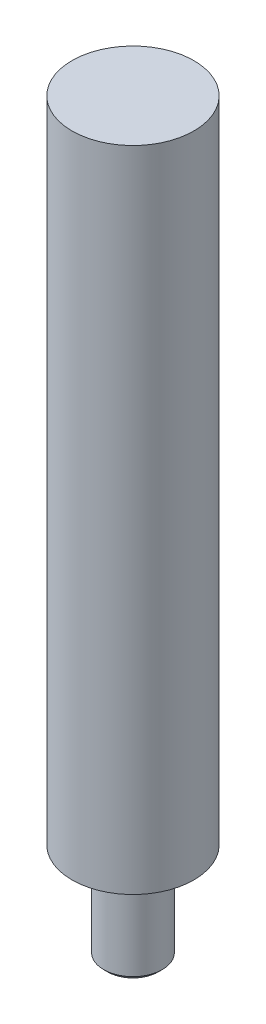
from build123d import *

# Parameters (mm, degrees)
SKETCH1_R           = 12.5
BOSS_EXTRUDE1_DEPTH = 133
SKETCH2_R           = 10
BOSS_EXTRUDE2_DEPTH = 20


# Read off the part's stored shape, not the designer's step: M12x1.5 Machine Threads Stud1
with BuildPart() as part:
    # Sketch1 → Boss-Extrude1 (new body)
    with BuildSketch(Plane(origin=(0, 0, 0), x_dir=(1, 0, 0), z_dir=(0, 1, 0))):
        with Locations(Location((0, 0, 0), (0, 0, 270))):
            Circle(SKETCH1_R)
    extrude(amount=BOSS_EXTRUDE1_DEPTH)

    # Sketch2 → Boss-Extrude2 (add)
    with BuildSketch(Plane.XZ):
        with Locations(Location((0, 0, 0), (0, 0, 270))):
            Circle(SKETCH2_R)
    extrude(amount=BOSS_EXTRUDE2_DEPTH)

    # M12x1.5 Machine Threads Stud1 outline → M12x1.5 Machine Threads Stud1 (revolve, cut)
    with BuildSketch(Plane.XY):
        Polygon((10, 0), (6, 0), (6, -19.172), (5.172, -20), (10, -20), align=None)
    revolve(axis=Axis((0, 0, 0), (0, 1, 0)), mode=Mode.SUBTRACT)


solid = part.part
